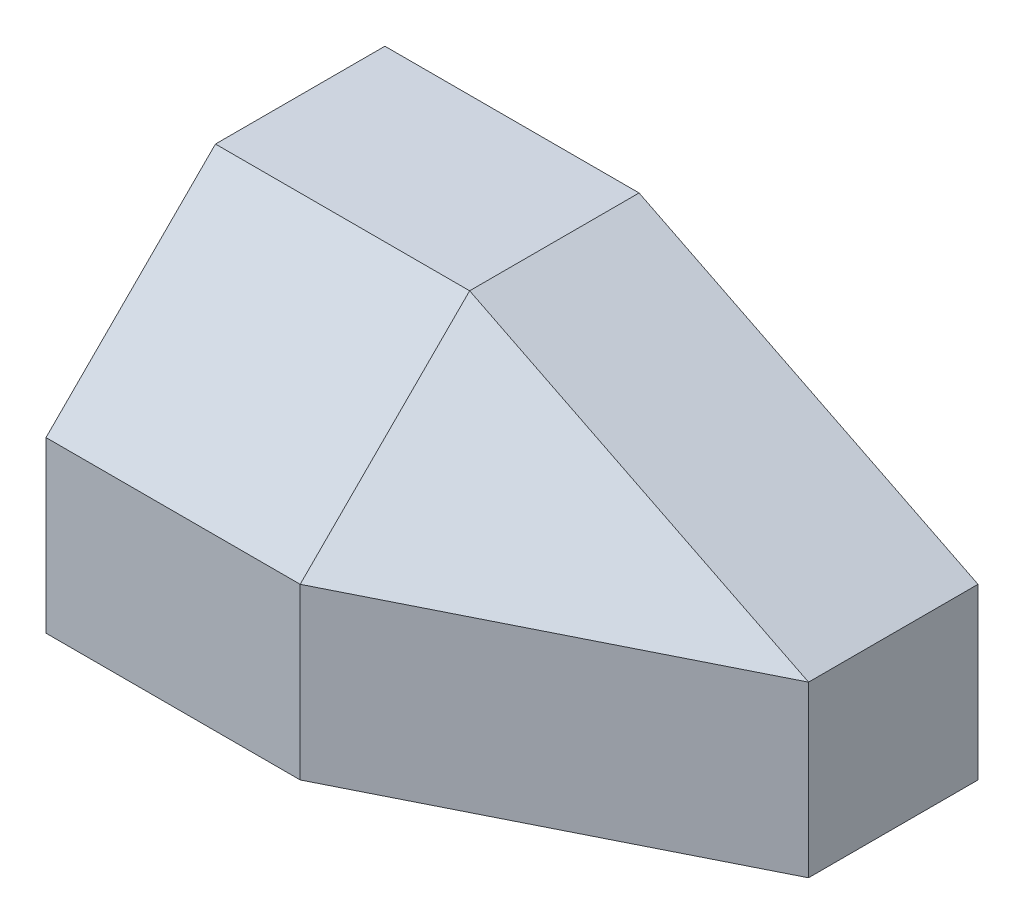
from build123d import *

# Parameters (mm, degrees)
SKETCH1_W           = 70
SKETCH1_H           = 20
BOSS_EXTRUDE1_DEPTH = 20
BOSS_EXTRUDE2_DEPTH = 20
BOSS_EXTRUDE3_DEPTH = 20
BOSS_EXTRUDE4_DEPTH = 30
BOSS_EXTRUDE6_START = 17
BOSS_EXTRUDE6_DEPTH = 14.666666667


with BuildPart() as part:
    # Sketch1 → Boss-Extrude1 (new body)
    with BuildSketch(Plane(origin=(0, 0, 0), x_dir=(1, 0, 0), z_dir=(0, 1, 0))):
        Rectangle(SKETCH1_W, SKETCH1_H)
    extrude(amount=BOSS_EXTRUDE1_DEPTH)

    # Sketch2 → Boss-Extrude2 (add)
    with BuildSketch(Plane.XY.offset(10)):
        Polygon((-35, 20), (-35, 40), (-5, 40), (35, 20), align=None)
    extrude(amount=-BOSS_EXTRUDE2_DEPTH)

    # Sketch4 → Boss-Extrude3 (add)
    with BuildSketch(Plane.XZ):
        Polygon((-35, 10), (-35, 30), (-5, 30), (35, 10), align=None)
    extrude(amount=-BOSS_EXTRUDE3_DEPTH)

    # Sketch5 → Boss-Extrude4 (add)
    with BuildSketch(Plane.ZY.offset(35)):
        Polygon((10, 40), (30, 20), (10, 20), align=None)
    extrude(amount=-BOSS_EXTRUDE4_DEPTH)

    # Boss-Extrude6: read off the stored shape, not the designer's step
    # Boss-Extrude6 outline → Boss-Extrude6 (add)
    with BuildSketch(Plane(origin=(0, 0, 0), x_dir=(0.9428090415820636, -0.23570226039551556, -0.2357022603955156), z_dir=(0.3333333333333329, 0.6666666666666667, 0.6666666666666669)).offset(BOSS_EXTRUDE6_START)):
        Polygon((-16.499158228, -7.071067812), (25.927248644, 7.071067812), (-16.499158228, 21.213203436), align=None)
    extrude(amount=BOSS_EXTRUDE6_DEPTH)


solid = part.part
